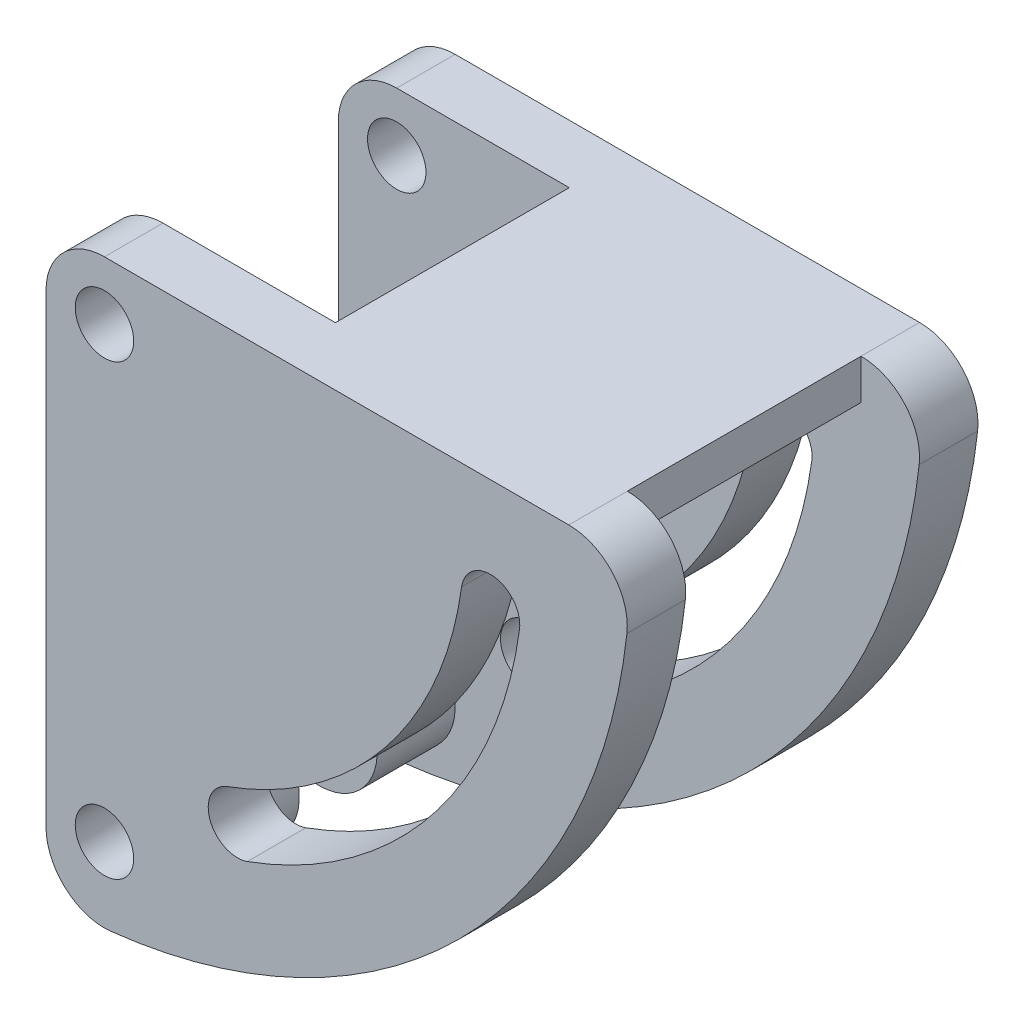
from build123d import *

# Parameters (mm, degrees)
SKETCH1_R           = 1.5
BOSS_EXTRUDE1_DEPTH = 3
LPATTERN1_COUNT     = 2
LPATTERN1_PITCH     = 15
FILLET2_R           = 3
FILLET3_R           = 3
BOSS_EXTRUDE2_REACH = 46.777
SKETCH2_W           = 14.977515773
SKETCH2_H           = 2.058823846
SKETCH3_R           = 3
SKETCH3_R_2         = 1.5
BOSS_EXTRUDE3_DEPTH = 4
LPATTERN2_COUNT     = 2
LPATTERN2_PITCH     = 8


with BuildPart() as part:
    # Sketch1 → Boss-Extrude1 (new body)
    with BuildSketch(Plane.XY):
        with BuildLine():
            Line((0, 0), (30, 0))
            ThreePointArc((30, 0), (21.213203436, -21.213203436), (0, -30))
            Line((0, -30), (0, 0))
        make_face()
        with Locations((3, -26)):
            Circle(SKETCH1_R, mode=Mode.SUBTRACT)
        with Locations((3, -3)):
            Circle(SKETCH1_R, mode=Mode.SUBTRACT)
        with BuildLine():
            ThreePointArc((21.329556778, -5.505463694), (17.394405246, -14.621148722), (9.313112731, -20.38949705))
            ThreePointArc((9.313112731, -20.38949705), (8.415027516, -22.311330275), (10.336860742, -23.20941549))
            ThreePointArc((10.336860742, -23.20941549), (19.728633123, -16.505659326), (24.301917337, -5.911755103))
            ThreePointArc((24.301917337, -5.911755103), (23.018882762, -4.222429119), (21.329556778, -5.505463694))
        make_face(mode=Mode.SUBTRACT)
    extrude(amount=BOSS_EXTRUDE1_DEPTH)


with BuildPart() as lpattern1_1:
    # LPattern1: pattern copy
    add(part.part.moved(Location(Vector(0, 0, 1) * (1 * LPATTERN1_PITCH))))

    # Fillet3
    fillet3_edges = [lpattern1_1.edges().sort_by_distance(p)[0] for p in [
        (0, -30, 16.5),
        (0, 0, 16.5),
        (30, 0, 16.5),
    ]]
    fillet(fillet3_edges, radius=FILLET3_R)

    # Sketch2 → Boss-Extrude2 (add, up to next)
    with BuildSketch(Plane.XY.offset(3), mode=Mode.PRIVATE) as boss_extrude2_sk1:
        with Locations((19.344057843, -1.029411923)):
            Rectangle(SKETCH2_W, SKETCH2_H)
    boss_extrude2_tool1 = extrude(boss_extrude2_sk1.sketch, amount=BOSS_EXTRUDE2_REACH, mode=Mode.PRIVATE) - lpattern1_1.part


with BuildPart() as part_1:
    add(part.part)

    # Fillet2
    fillet2_edges = [part_1.edges().sort_by_distance(p)[0] for p in [
        (0, -30, 1.5),
        (0, 0, 1.5),
        (30, 0, 1.5),
    ]]
    fillet(fillet2_edges, radius=FILLET2_R)


with BuildPart() as lpattern1_1_1:
    add(lpattern1_1.part)

    add(part_1.part)  # Boss-Extrude2 merges part
    add(boss_extrude2_tool1.solids().sort_by_distance((19.344058, -1.029412, 3))[0])

    # Sketch3 → Boss-Extrude3 (add)
    with BuildSketch(Plane(origin=(0, 0, 15), x_dir=(-1, 0, 0), z_dir=(0, 0, -1))):
        with Locations((-3, -26)):
            Circle(SKETCH3_R)
        with Locations((-3, -26)):
            Circle(SKETCH3_R_2, mode=Mode.SUBTRACT)
    boss_extrude3 = extrude(amount=BOSS_EXTRUDE3_DEPTH)

    # LPattern2: Boss-Extrude3 ×2
    with Locations(*[(0, 0, -i * LPATTERN2_PITCH) for i in range(1, LPATTERN2_COUNT)]):
        add(boss_extrude3)


solid = lpattern1_1_1.part
